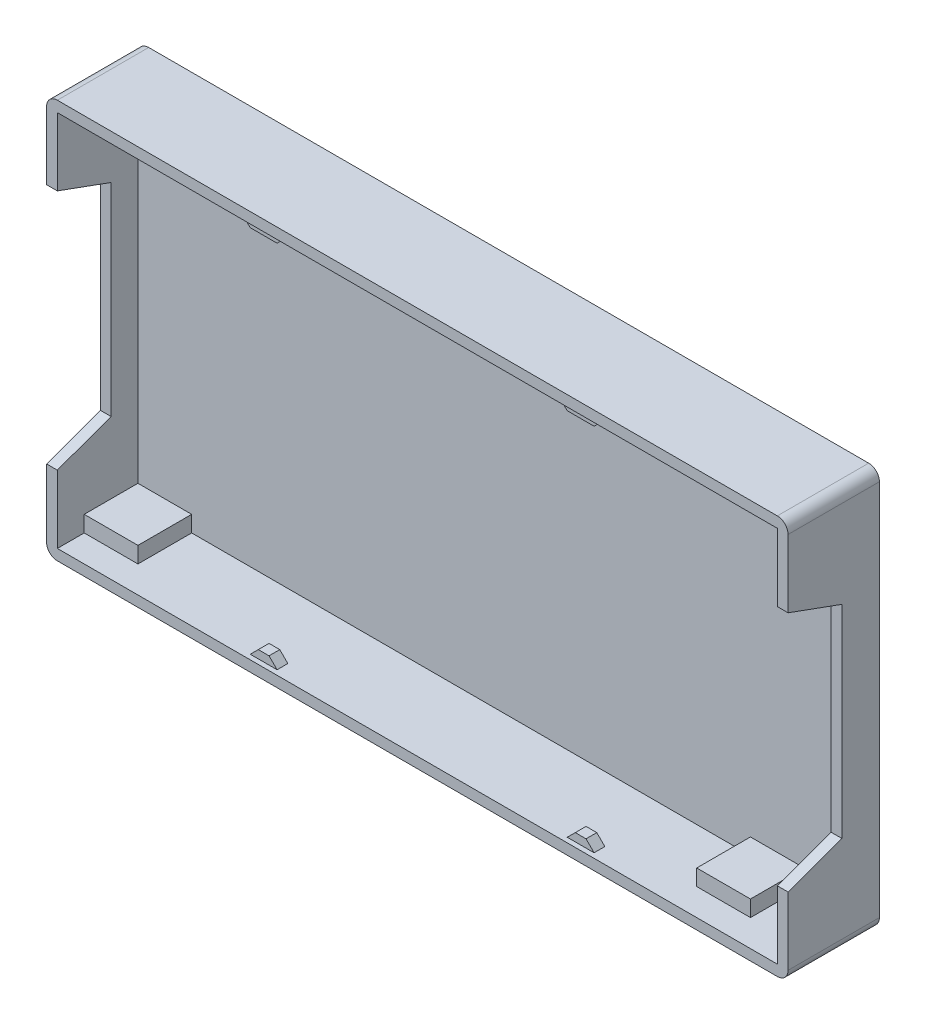
from build123d import *

# Parameters (mm, degrees)
SKETCH1_W                            = 74.25
SKETCH1_H                            = 138
SKETCH1_W_2                          = 70.25
SKETCH1_H_2                          = 134
BOSS_EXTRUDE1_BOARD_4MM_DEPTH        = 5
SKETCH2_W                            = 138
SKETCH2_H                            = 74.25
BOSS_EXTRUDE2_UNDER_10MS_DEPTH       = 10
SKETCH3_W                            = 138
SKETCH3_H                            = 74.25
BOSS_EXTRUDE3_BOTTOM_COVER_2MM_DEPTH = 2
SKETCH4_W                            = 5
SKETCH4_H                            = 3.5
BOSS_EXTRUDE4_4PINS_DEPTH            = 2
SKETCH5_W                            = 150
SKETCH5_H                            = 45
CUT_EXTRUDE1_CUT_USB_DEPTH           = 10
CUT_EXTRUDE1_CUT_USB_DRAFT           = -20
FILLET1_R                            = 2
CHAMFER2_START                       = 2.1
CHAMFER2_DEPTH                       = 2
CHAMFER2_2_DEPTH                     = 2


with BuildPart() as part:
    # Sketch1 → Boss-Extrude1-board-4mm (new body)
    with BuildSketch(Plane(origin=(0, 0, 0), x_dir=(0, 1, 0), z_dir=(0, 0, 1))):
        Rectangle(SKETCH1_W, SKETCH1_H)
        Rectangle(SKETCH1_W_2, SKETCH1_H_2, mode=Mode.SUBTRACT)
    extrude(amount=BOSS_EXTRUDE1_BOARD_4MM_DEPTH)

    # Sketch2 → Boss-Extrude2-under-10ms (add)
    with BuildSketch(Plane(origin=(0, 0, 0), x_dir=(1, 0, 0), z_dir=(0, 0, -1))):
        Rectangle(SKETCH2_W, SKETCH2_H)
        Polygon((-67, 32.125), (-57, 32.125), (-57, 35.125), (47, 35.125), (47, 32.125), (57, 32.125), (57, 35.125), (67, 35.125), (67, -35.125), (57, -35.125), (57, -32.125), (47, -32.125), (47, -35.125), (-57, -35.125), (-57, -32.125), (-67, -32.25), align=None, mode=Mode.SUBTRACT)
    extrude(amount=BOSS_EXTRUDE2_UNDER_10MS_DEPTH)

    # Sketch3 → Boss-Extrude3-bottom-cover-2mm (add)
    with BuildSketch(Plane(origin=(0, 0, -10), x_dir=(1, 0, 0), z_dir=(0, 0, -1))):
        Rectangle(SKETCH3_W, SKETCH3_H)
    extrude(amount=BOSS_EXTRUDE3_BOTTOM_COVER_2MM_DEPTH)

    # Sketch4 → Boss-Extrude4-4pins (add)
    with BuildSketch(Plane.XY.offset(2.1)):
        with Locations((-29.5, 35.375)):
            Rectangle(SKETCH4_W, SKETCH4_H)
        with Locations((-29.5, -35.375)):
            Rectangle(SKETCH4_W, SKETCH4_H)
        with Locations((29.5, -35.375)):
            Rectangle(SKETCH4_W, SKETCH4_H)
        with Locations((29.5, 35.375)):
            Rectangle(SKETCH4_W, SKETCH4_H)
    extrude(amount=BOSS_EXTRUDE4_4PINS_DEPTH)


with BuildPart() as cut_extrude1_cut_usb_tool:
    # Sketch5 → Cut-Extrude1-cut-usb (with draft: the straight prism first)
    with BuildSketch(Plane.XY.offset(5)):
        Rectangle(SKETCH5_W, SKETCH5_H)
    extrude(amount=-CUT_EXTRUDE1_CUT_USB_DEPTH)
    # Cut-Extrude1-cut-usb: the draft: its side faces are tilted about the plane it starts from
    cut_extrude1_cut_usb_sides = [cut_extrude1_cut_usb_tool.faces().sort_by_distance(p)[0] for p in [
        (0, -22.5, 0),
        (75, 0, 0),
        (0, 22.5, 0),
        (-75, 0, 0),
    ]]
    draft(cut_extrude1_cut_usb_sides, Plane.XY.offset(5), CUT_EXTRUDE1_CUT_USB_DRAFT)


with BuildPart() as part_1:
    add(part.part)

    # Cut-Extrude1-cut-usb: cut by cut_extrude1_cut_usb_tool
    add(cut_extrude1_cut_usb_tool.part, mode=Mode.SUBTRACT)

    # Fillet1
    fillet1_edges = [part_1.edges().sort_by_distance(p)[0] for p in [
        (69, -37.125, -3.5),
        (-69, -37.125, -3.5),
        (-69, 37.125, -3.5),
        (69, 37.125, -3.5),
    ]]
    fillet(fillet1_edges, radius=FILLET1_R)

    # Chamfer2: read off the stored shape, not the designer's step
    # Chamfer2 outline → Chamfer2 (cut)
    with BuildSketch(Plane.XY.offset(CHAMFER2_START)):
        Polygon((-32, -33.625), (-32, -35.125), (-30.5, -33.625), align=None)
        Polygon((-27, -33.625), (-28.5, -33.625), (-27, -35.125), align=None)
        Polygon((27, -33.625), (27, -35.125), (28.5, -33.625), align=None)
        Polygon((32, -33.625), (30.5, -33.625), (32, -35.125), align=None)
    extrude(amount=CHAMFER2_DEPTH, mode=Mode.SUBTRACT)

    # Chamfer2 2 outline → Chamfer2 2 (add)
    with BuildSketch(Plane.XY.offset(CHAMFER2_START)):
        Polygon((-32, 33.625), (-32, 35.125), (-33.5, 35.125), align=None)
        Polygon((-27, 33.625), (-25.5, 35.125), (-27, 35.125), align=None)
        Polygon((33.5, 35.125), (32, 35.125), (32, 33.625), align=None)
        Polygon((25.5, 35.125), (27, 33.625), (27, 35.125), align=None)
    extrude(amount=CHAMFER2_2_DEPTH)


solid = part_1.part
